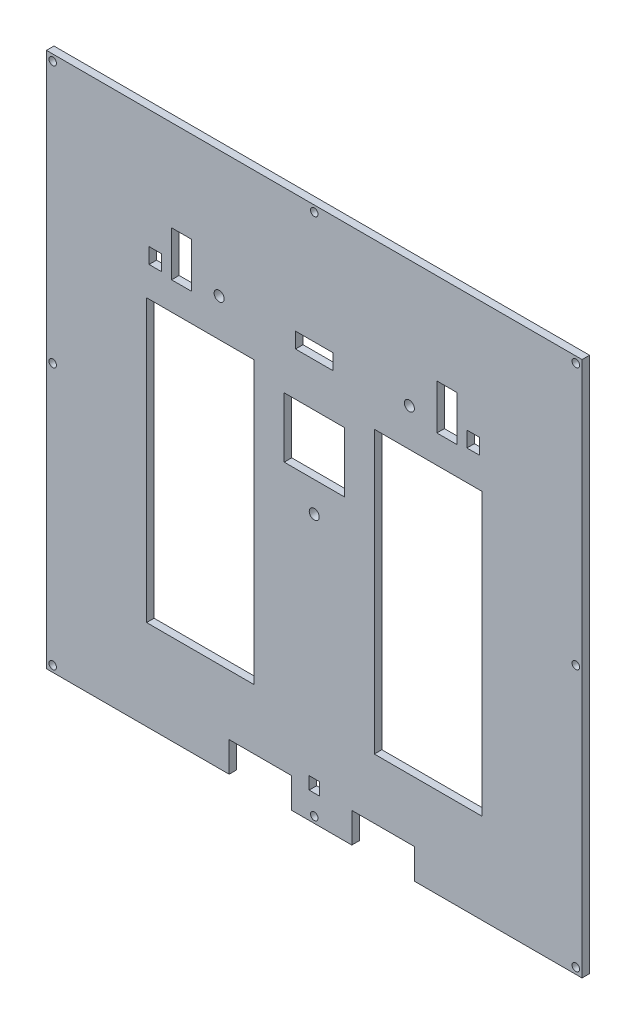
from build123d import *

# Parameters (mm, degrees)
SKETCH1_R           = 1.5
SKETCH1_R_2         = 2
SKETCH1_W           = 8
SKETCH1_H           = 18
SKETCH1_W_2         = 5
SKETCH1_H_2         = 6.2
SKETCH1_W_3         = 4.1
SKETCH1_H_3         = 5
SKETCH1_W_4         = 15
SKETCH1_W_5         = 43
SKETCH1_H_4         = 112.4
BOSS_EXTRUDE1_DEPTH = 3
SKETCH3_W           = 25
SKETCH3_H           = 12
SKETCH3_W_2         = 24
SKETCH3_H_2         = 24
CUT_EXTRUDE2_DEPTH  = 152.350586388


with BuildPart() as part:
    # Sketch1 → Boss-Extrude1 (new body)
    with BuildSketch(Plane.XY):
        Polygon((89, 107), (107, 107), (107, 52.4), (107, -107), (-107, -107), (-107, 52.4), (-107, 107), (-89, 107), align=None)
        with Locations((-104.5, 104.5)):
            Circle(SKETCH1_R, mode=Mode.SUBTRACT)
        with Locations((104.5, 104.5)):
            Circle(SKETCH1_R, mode=Mode.SUBTRACT)
        with Locations((104.5, 0)):
            Circle(SKETCH1_R, mode=Mode.SUBTRACT)
        with Locations((-38, 56.5)):
            Circle(SKETCH1_R_2, mode=Mode.SUBTRACT)
        with Locations((0, 104.5)):
            Circle(SKETCH1_R, mode=Mode.SUBTRACT)
        with Locations((104.5, -104.5)):
            Circle(SKETCH1_R, mode=Mode.SUBTRACT)
        Circle(SKETCH1_R_2, mode=Mode.SUBTRACT)
        with Locations((0, -104.5)):
            Circle(SKETCH1_R, mode=Mode.SUBTRACT)
        with Locations((-104.5, -104.5)):
            Circle(SKETCH1_R, mode=Mode.SUBTRACT)
        with Locations((-104.5, 0)):
            Circle(SKETCH1_R, mode=Mode.SUBTRACT)
        with Locations((38, 56.5)):
            Circle(SKETCH1_R_2, mode=Mode.SUBTRACT)
        with Locations((53, 61.6)):
            Rectangle(SKETCH1_W, SKETCH1_H, mode=Mode.SUBTRACT)
        with Locations((-63.5, 56.5)):
            Rectangle(SKETCH1_W_2, SKETCH1_H_2, mode=Mode.SUBTRACT)
        with Locations((63.5, 56.5)):
            Rectangle(SKETCH1_W_2, SKETCH1_H_2, mode=Mode.SUBTRACT)
        with Locations((0, -94)):
            Rectangle(SKETCH1_W_3, SKETCH1_H_3, mode=Mode.SUBTRACT)
        with Locations((-53, 61.6)):
            Rectangle(SKETCH1_W, SKETCH1_H, mode=Mode.SUBTRACT)
        with Locations((0, 56.5)):
            Rectangle(SKETCH1_W_4, SKETCH1_H_2, mode=Mode.SUBTRACT)
        with Locations((45.5, -14.8)):
            Rectangle(SKETCH1_W_5, SKETCH1_H_4, mode=Mode.SUBTRACT)
        with Locations((-45.5, -14.8)):
            Rectangle(SKETCH1_W_5, SKETCH1_H_4, mode=Mode.SUBTRACT)
    extrude(amount=BOSS_EXTRUDE1_DEPTH)

    # Sketch3 → Cut-Extrude2 (cut, through all)
    with BuildSketch(Plane.XY.offset(3)):
        with Locations((-21.5, -101)):
            Rectangle(SKETCH3_W, SKETCH3_H)
        with Locations((27.5, -101)):
            Rectangle(SKETCH3_W, SKETCH3_H)
        with Locations((0, 24)):
            Rectangle(SKETCH3_W_2, SKETCH3_H_2)
    extrude(amount=-CUT_EXTRUDE2_DEPTH, mode=Mode.SUBTRACT)


solid = part.part
